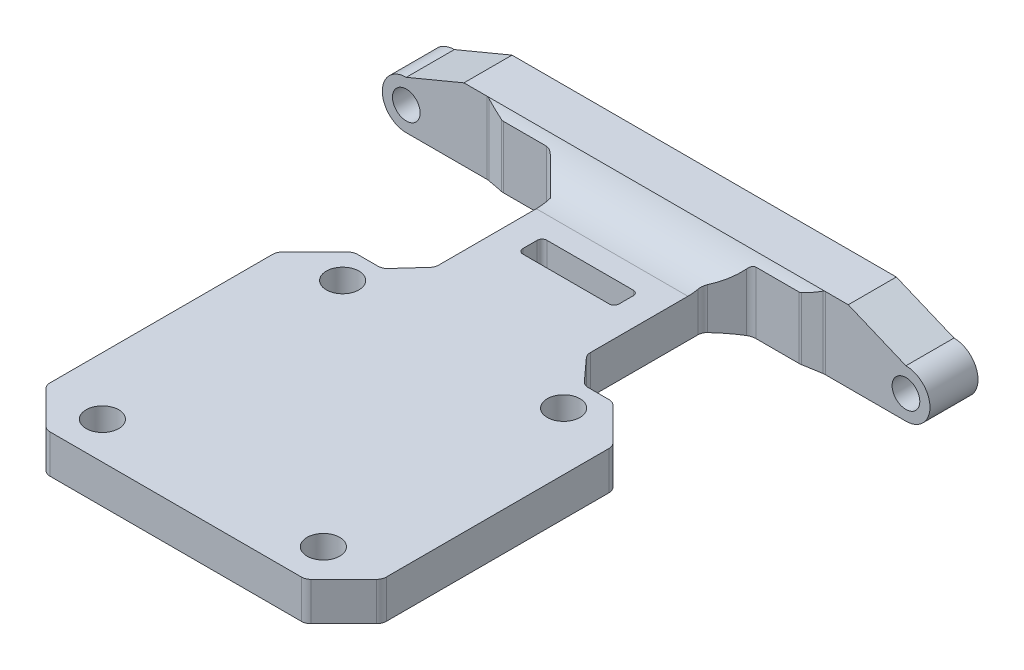
from build123d import *

# Parameters (mm, degrees)
SKETCH_1_R                      = 1.440775231
EXTRUDE_1_DEPTH                 = 5
SKETCH_3_W                      = 35
SKETCH_3_H                      = 4
EXTRUDE_2_DEPTH                 = 50
FILLET_1_R                      = 10
FILLET_2_R                      = 5
CUT_EXTRUDE_2_DEPTH             = 63.339794674
CUT_EXTRUDE_2_DEPTH_BACK        = 63.339794674
CUT_EXTRUDE_3_REACH             = 64.34
SKETCH_5_R                      = 1.7
SKETCH_5_W                      = 10
SKETCH_5_H                      = 2.5
CUT_EXTRUDE_3_DIRECTION_2_DEPTH = 63.339794674
FILLET_3_R                      = 0.5
FILLET_4_R                      = 1


with BuildPart() as part:
    # 草图1 → 凸台-拉伸1 (new body)
    with BuildSketch(Plane.XY):
        with BuildLine():
            Line((-26, -2.5), (26, -2.5))
            ThreePointArc((26, -2.5), (28.5, 0), (26, 2.5))
            Line((26, 2.5), (20, 5))
            Line((20, 5), (-20, 5))
            Line((-20, 5), (-26, 2.5))
            ThreePointArc((-26, 2.5), (-28.5, 0), (-26, -2.5))
        make_face()
        with Locations((-26, 0)):
            Circle(SKETCH_1_R, mode=Mode.SUBTRACT)
        with Locations(Location((26, 0, 0), (0, 0, 180))):
            Circle(SKETCH_1_R, mode=Mode.SUBTRACT)
    extrude(amount=EXTRUDE_1_DEPTH)

    # 草图3 → 凸台-拉伸2 (add)
    with BuildSketch(Plane.XY.offset(5)):
        Rectangle(SKETCH_3_W, SKETCH_3_H)
    extrude(amount=EXTRUDE_2_DEPTH)

    # 圆角1
    # the kernel refuses this fillet: 10 mm, written as the material it adds along each edge
    with BuildSketch(Plane(origin=(17.5, -2, 5), x_dir=(0, -1.0, 2.1849189124477904e-12), z_dir=(-1, 0, 0))) as fillet_1_piece_1:
        with BuildLine():
            CenterArc((10, 3.122498999), FILLET_1_R, 180, 18.194872339)
            Line((0, 3.122498999), (-0.2, 3.122498999))
            Line((-0.2, 3.122498999), (-0.2, 0))
            Line((-0.2, 0), (0, -0.2))
            ThreePointArc((0, -0.2), (0.25, -0.2), (0.31, -0.06244998))
            Line((0.31, -0.06244998), (0.5, 0))
        make_face()
    extrude(amount=35)

    # 圆角2
    # the kernel refuses this fillet: 5 mm, written as the material it adds along each edge
    with BuildSketch(Plane(origin=(-17.5, 2, 5), x_dir=(0, 0, 1), z_dir=(1, 0, 0))) as fillet_2_piece_1:
        with BuildLine():
            CenterArc((4.582575695, -5), FILLET_2_R, 90, 66.421821522)
            Line((0, -3), (-0.091651514, -2.96))
            ThreePointArc((-0.091651514, -2.96), (-0.1, -1.5), (-0.1, 0))
            Line((-0.1, 0), (0, 0.1))
            Line((0, 0.1), (4.582575695, 0.1))
            Line((4.582575695, 0.1), (4.582575695, 0))
        make_face()
    extrude(amount=35)

    # 草图4 → 切除-拉伸2 (cut, two sides: drawn at the far end of the back side and taken through both)
    with BuildSketch(Plane.XZ.offset(2).offset(-CUT_EXTRUDE_2_DEPTH_BACK)):
        Polygon((-17.5, 51), (-13.5, 55), (-17.5, 55), align=None)
        Polygon((-13.5, 23), (-17.5, 27), (-17.5, 5), (-15.5, 5.511275368), (-10.5, 5.511275368), (-7.888776369, 8.122498999), (-7.888776369, 20.122498999), (-10.5, 23), align=None)
        Polygon((17.5, 5), (17.5, 27), (13.5, 23), (10.5, 23), (7.888776369, 20.122498999), (7.888776369, 8.122498999), (10.5, 5.511275368), (15.5, 5.511275368), align=None)
        Polygon((17.5, 51), (17.5, 55), (13.5, 55), align=None)
    extrude(amount=CUT_EXTRUDE_2_DEPTH + CUT_EXTRUDE_2_DEPTH_BACK, mode=Mode.SUBTRACT)

    # 草图5 → 切除-拉伸3 (cut, up to next)
    with BuildSketch(Plane.XZ.offset(2), mode=Mode.PRIVATE) as cut_extrude_3_sk1:
        with Locations(Location((-11.5, 26.128065597, 0), (0, 0, 180))):
            Circle(SKETCH_5_R)
    cut_extrude_3_tool1 = extrude(cut_extrude_3_sk1.sketch, amount=-CUT_EXTRUDE_3_REACH, mode=Mode.PRIVATE) & part.part
    # 草图5 → 切除-拉伸3 (cut, up to next)
    with BuildSketch(Plane.XZ.offset(2), mode=Mode.PRIVATE) as cut_extrude_3_sk2:
        with Locations(Location((11.5, 26.128065597, 0), (0, 0, 180))):
            Circle(SKETCH_5_R)
    cut_extrude_3_tool2 = extrude(cut_extrude_3_sk2.sketch, amount=-CUT_EXTRUDE_3_REACH, mode=Mode.PRIVATE) & part.part
    # 草图5 → 切除-拉伸3 (cut, up to next)
    with BuildSketch(Plane.XZ.offset(2), mode=Mode.PRIVATE) as cut_extrude_3_sk3:
        with Locations(Location((11.5, 51.128065597, 0), (0, 0, 180))):
            Circle(SKETCH_5_R)
    cut_extrude_3_tool3 = extrude(cut_extrude_3_sk3.sketch, amount=-CUT_EXTRUDE_3_REACH, mode=Mode.PRIVATE) & part.part
    # 草图5 → 切除-拉伸3 (cut, up to next)
    with BuildSketch(Plane.XZ.offset(2), mode=Mode.PRIVATE) as cut_extrude_3_sk4:
        with Locations(Location((-11.5, 51.128065597, 0), (0, 0, 180))):
            Circle(SKETCH_5_R)
    cut_extrude_3_tool4 = extrude(cut_extrude_3_sk4.sketch, amount=-CUT_EXTRUDE_3_REACH, mode=Mode.PRIVATE) & part.part
    # 草图5 → 切除-拉伸3 (cut, up to next)
    with BuildSketch(Plane.XZ.offset(2), mode=Mode.PRIVATE) as cut_extrude_3_sk5:
        with Locations((0, 13.122498999)):
            Rectangle(SKETCH_5_W, SKETCH_5_H)
    cut_extrude_3_tool5 = extrude(cut_extrude_3_sk5.sketch, amount=-CUT_EXTRUDE_3_REACH, mode=Mode.PRIVATE) & part.part
    add(cut_extrude_3_tool1.solids().sort_by_distance((-11.5, -2, 26.128066))[0], mode=Mode.SUBTRACT)
    add(cut_extrude_3_tool2.solids().sort_by_distance((11.5, -2, 26.128066))[0], mode=Mode.SUBTRACT)
    add(cut_extrude_3_tool3.solids().sort_by_distance((11.5, -2, 51.128066))[0], mode=Mode.SUBTRACT)
    add(cut_extrude_3_tool4.solids().sort_by_distance((-11.5, -2, 51.128066))[0], mode=Mode.SUBTRACT)
    add(cut_extrude_3_tool5.solids().sort_by_distance((0, -2, 13.122499))[0], mode=Mode.SUBTRACT)

    # 草图5 → 切除-拉伸3 direction 2 (cut)
    with BuildSketch(Plane.XZ.offset(2)):
        with Locations(Location((-11.5, 26.128065597, 0), (0, 0, 180))):
            Circle(SKETCH_5_R)
        with Locations(Location((11.5, 26.128065597, 0), (0, 0, 180))):
            Circle(SKETCH_5_R)
        with Locations(Location((11.5, 51.128065597, 0), (0, 0, 180))):
            Circle(SKETCH_5_R)
        with Locations(Location((-11.5, 51.128065597, 0), (0, 0, 180))):
            Circle(SKETCH_5_R)
        with Locations((0, 13.122498999)):
            Rectangle(SKETCH_5_W, SKETCH_5_H)
    extrude(amount=CUT_EXTRUDE_3_DIRECTION_2_DEPTH, mode=Mode.SUBTRACT)

    # 圆角3
    fillet_3_edges = [part.edges().sort_by_distance(p)[0] for p in [
        (5, 0, 11.872498999),
        (5, 0, 14.372498999),
        (-5, 0, 14.372498999),
        (-5, 0, 11.872498999),
    ]]
    fillet(fillet_3_edges, radius=FILLET_3_R)

    # 圆角4
    fillet_4_edges = [part.edges().sort_by_distance(p)[0] for p in [
        (17.5, 0, 51),
        (13.5, 0, 55),
        (17.5, 0, 27),
        (13.5, 0, 23),
        (10.5, 0, 23),
        (7.888776369, 0, 20.122498999),
        (7.888776369, 0.108965912, 8.122498999),
        (10.5, 0.875277907, 5.511275368),
        (15.5, 0.875277907, 5.511275368),
        (17.5, 1.25, 5),
        (-17.5, 1.25, 5),
        (-15.5, 0.875277907, 5.511275368),
        (-10.5, 0.875277907, 5.511275368),
        (-7.888776369, 0, 20.122498999),
        (-10.5, 0, 23),
        (-13.5, 0, 23),
        (-17.5, 0, 27),
        (-17.5, 0, 51),
        (-13.5, 0, 55),
    ]]
    fillet(fillet_4_edges, radius=FILLET_4_R)


solid = part.part
